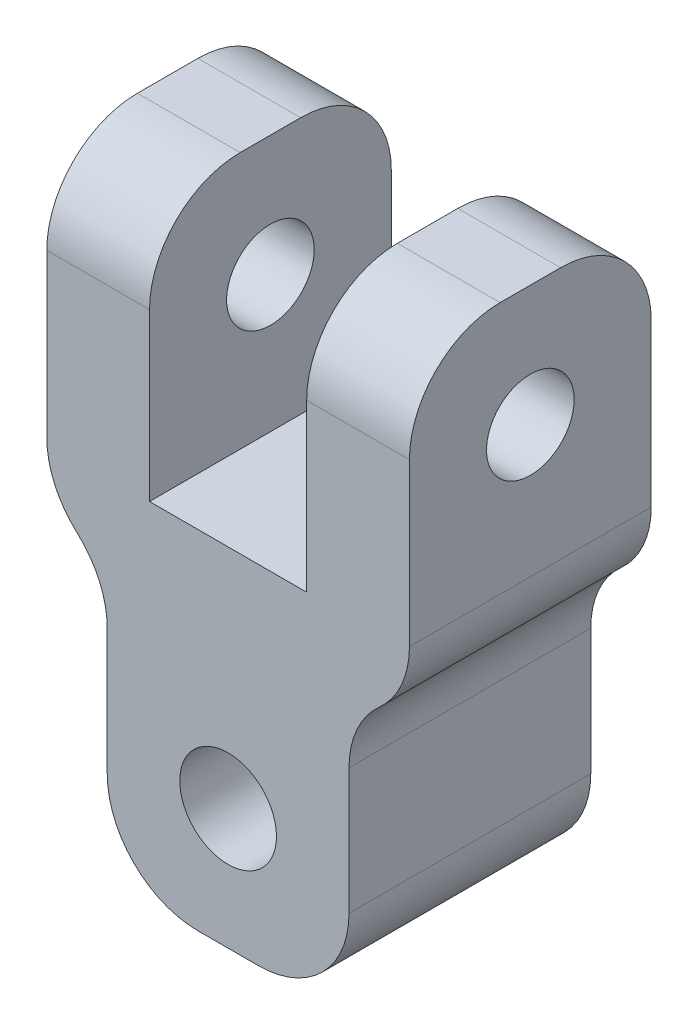
from build123d import *

# Parameters (mm, degrees)
SKETCH_1_W          = 8
SKETCH_1_H          = 8
EXTRUDE_1_DEPTH     = 20
SKETCH_2_R          = 1.6
CUT_EXTRUDE_1_DEPTH = 23.978250586
SKETCH_4_W          = 2
SKETCH_4_H          = 8
EXTRUDE_3_DEPTH     = 10
SKETCH_5_W          = 5.2
SKETCH_5_H          = 8.5
CUT_EXTRUDE_2_DEPTH = 24.748684174
FILLET_1_R          = 3
SKETCH_6_R          = 1.45
CUT_EXTRUDE_3_DEPTH = 25.657656012
FILLET_2_R          = 3


with BuildPart() as part:
    # 草图1 → 凸台-拉伸1 (new body)
    with BuildSketch(Plane(origin=(0, 0, 0), x_dir=(1, 0, 0), z_dir=(0, 1, 0))):
        with Locations((4, -4)):
            Rectangle(SKETCH_1_W, SKETCH_1_H)
    extrude(amount=EXTRUDE_1_DEPTH)

    # 草图2 → 切除-拉伸1 (cut, through all)
    with BuildSketch(Plane.XY.offset(8)):
        with Locations((4, 4)):
            Circle(SKETCH_2_R)
    extrude(amount=-CUT_EXTRUDE_1_DEPTH, mode=Mode.SUBTRACT)

    # 草图4 → 凸台-拉伸3 (add)
    with BuildSketch(Plane(origin=(0, 20, 0), x_dir=(1, 0, 0), z_dir=(0, 1, 0))):
        with Locations((-1, -4)):
            Rectangle(SKETCH_4_W, SKETCH_4_H)
        with Locations((9, -4)):
            Rectangle(SKETCH_4_W, SKETCH_4_H)
    extrude(amount=-EXTRUDE_3_DEPTH)

    # 草图5 → 切除-拉伸2 (cut, through all)
    with BuildSketch(Plane.XY.offset(8)):
        with Locations((4, 15.75)):
            Rectangle(SKETCH_5_W, SKETCH_5_H)
    extrude(amount=-CUT_EXTRUDE_2_DEPTH, mode=Mode.SUBTRACT)

    # 圆角1
    # the kernel refuses this fillet: 3 mm, written as the material it adds along each edge
    with BuildSketch(Plane(origin=(8, 10, 8), x_dir=(0, -1, 0), z_dir=(0, 0, -1))) as fillet_1_piece_1:
        with BuildLine():
            CenterArc((2.828427125, -3), FILLET_1_R, 90, 70.528779366)
            Line((0, -2), (-0.056568542, -1.98))
            ThreePointArc((-0.056568542, -1.98), (-0.06, -1), (-0.06, 0))
            Line((-0.06, 0), (0, 0.06))
            Line((0, 0.06), (2.828427125, 0.06))
            Line((2.828427125, 0.06), (2.828427125, 0))
        make_face()
    extrude(amount=8)
    with BuildSketch(Plane(origin=(0, 10, 8), x_dir=(-1, 0, 0), z_dir=(0, 0, -1))) as fillet_1_piece_2:
        with BuildLine():
            CenterArc((3, -2.828427125), FILLET_1_R, 109.471220634, 70.528779366)
            Line((0, -2.828427125), (-0.06, -2.828427125))
            Line((-0.06, -2.828427125), (-0.06, 0))
            Line((-0.06, 0), (0, 0.06))
            ThreePointArc((0, 0.06), (1, 0.06), (1.98, 0.056568542))
            Line((1.98, 0.056568542), (2, 0))
        make_face()
    extrude(amount=8)

    # 草图6 → 切除-拉伸3 (cut, through all)
    with BuildSketch(Plane(origin=(10, 0, 0), x_dir=(0, 0, -1), z_dir=(1, 0, 0))):
        with Locations((-4, 16)):
            Circle(SKETCH_6_R)
    extrude(amount=-CUT_EXTRUDE_3_DEPTH, mode=Mode.SUBTRACT)

    # 圆角2
    fillet_2_edges = [part.edges().sort_by_distance(p)[0] for p in [
        (8.3, 20, 0),
        (-2, 10, 4),
        (10, 10, 4),
        (-0.3, 20, 0),
        (8.3, 20, 8),
        (8, 0, 4),
        (0, 0, 4),
        (-0.3, 20, 8),
    ]]
    fillet(fillet_2_edges, radius=FILLET_2_R)


solid = part.part
